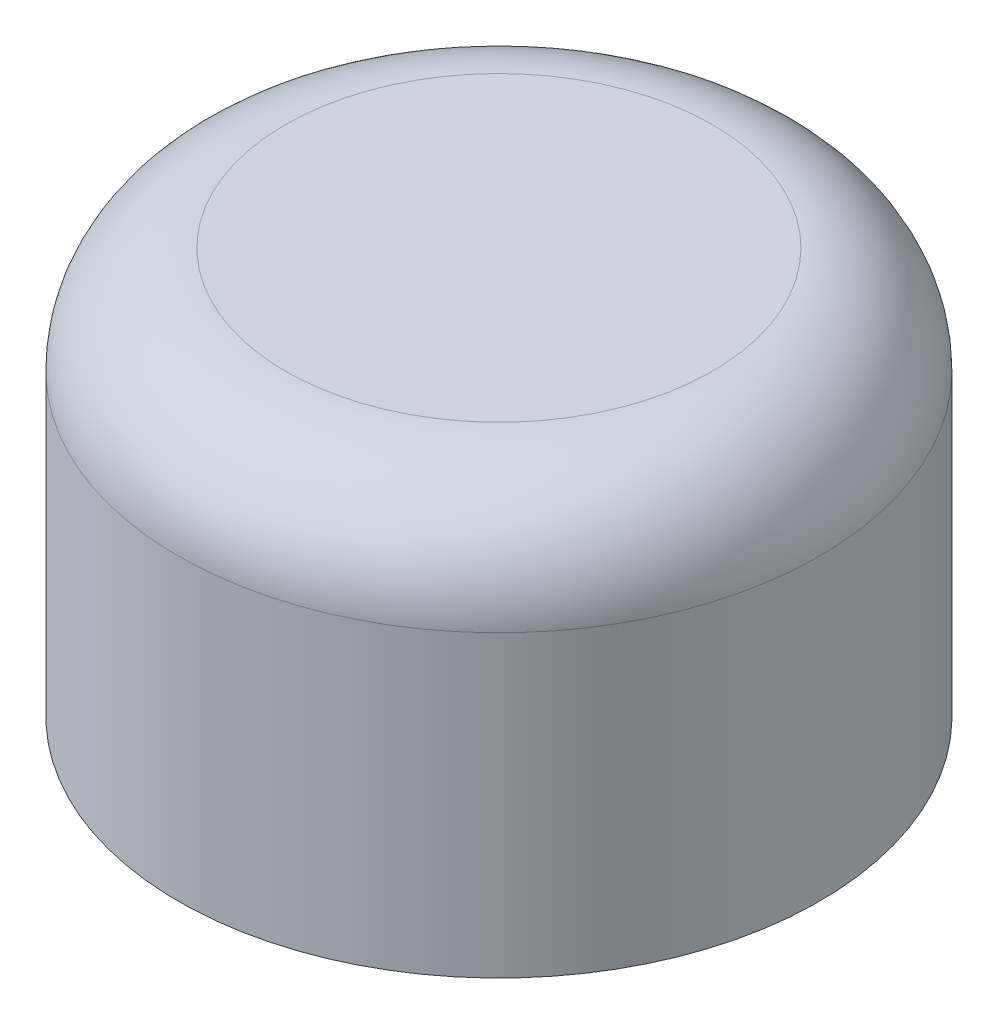
from build123d import *

# Parameters (mm, degrees)
EXTRUDE_1_DEPTH = 13


with BuildPart() as part:
    # ｽｹｯﾁ1 → 回転1 (revolve)
    with BuildSketch(Plane.XY):
        with BuildLine():
            Line((0, 20), (10, 20))
            ThreePointArc((10, 20), (13.535533906, 18.535533906), (15, 15))
            Line((15, 15), (15, 1))
            Line((15, 1), (13, 1))
            Line((13, 1), (13, 3.5))
            Line((13, 3.5), (0, 3.5))
            Line((0, 3.5), (0, 6.5))
            Line((0, 6.5), (13, 6.5))
            Line((13, 6.5), (13, 15))
            ThreePointArc((13, 15), (12.121320344, 17.121320344), (10, 18))
            Line((10, 18), (0, 18))
            Line((0, 18), (0, 20))
        make_face()
    revolve(axis=Axis((0, 3.5, 0), (0, 1, 0)))

    # ｽｹｯﾁ2 → ﾎﾞｽ - 押し出し1 (add)
    with BuildSketch(Plane(origin=(0, 6.5, 0), x_dir=(1, 0, 0), z_dir=(0, 1, 0))):
        Polygon((-1, 1), (-1, 8), (1, 8), (1, 1), (8, 1), (8, -1), (1, -1), (1, -8), (-1, -8), (-1, -1), (-8, -1), (-8, 1), align=None)
    extrude(amount=EXTRUDE_1_DEPTH)


solid = part.part
